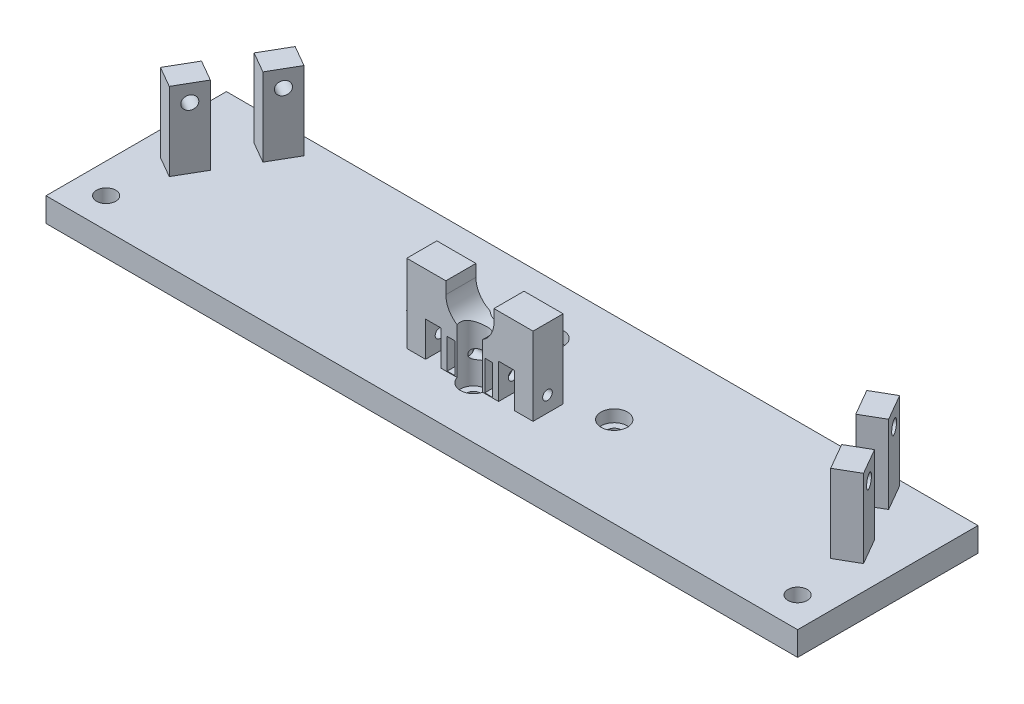
from build123d import *

# Parameters (mm, degrees)
SKETCH_1_W                = 125
SKETCH_1_H                = 30
EXTRUDE_1_DEPTH           = 4
EXTRUDE_3_DEPTH           = 5
SKETCH_11_R               = 0.8
CUT_EXTRUDE_6_DEPTH       = 77.439518575
CUT_EXTRUDE_7_DEPTH       = 1.3
CUT_EXTRUDE_8_DEPTH       = 1.3
EXTRUDE_4_DEPTH           = 13
SKETCH_15_R               = 1.1
CUT_EXTRUDE_9_DEPTH       = 115.99682112
SKETCH_16_R               = 1.1
CUT_EXTRUDE_10_DEPTH      = 115.99682112
CUT_EXTRUDE_11_DEPTH      = 66.576291447
CUT_EXTRUDE_11_DEPTH_BACK = 66.576291447
SKETCH_17_R               = 1.1
SKETCH_17_R_2             = 2.6
CUT_EXTRUDE_12_DEPTH      = 66.576291447
CUT_EXTRUDE_12_DEPTH_BACK = 2
SKETCH_18_R               = 2.2
SKETCH_19_R               = 1.6
CUT_EXTRUDE_13_DEPTH      = 66.576291447


with BuildPart() as part:
    # Эскиз1 → Бобышка-Вытянуть1 (new body)
    with BuildSketch(Plane(origin=(0, 0, 0), x_dir=(1, 0, 0), z_dir=(0, 1, 0))):
        Rectangle(SKETCH_1_W, SKETCH_1_H)
    extrude(amount=EXTRUDE_1_DEPTH)

    # Эскиз4 → Бобышка-Вытянуть3 (add)
    with BuildSketch(Plane.XY.offset(7)):
        with BuildLine():
            Line((-4, 15), (-4, 17))
            Line((-4, 17), (-10.5, 17))
            Line((-10.5, 17), (-10.5, 4))
            Line((-10.5, 4), (-7.375, 4))
            Line((-7.375, 4), (-7.375, 9.8))
            Line((-7.375, 9.8), (-4.775, 9.8))
            Line((-4.775, 9.8), (-4.775, 4))
            Line((-4.775, 4), (4.775, 4))
            Line((4.775, 4), (4.775, 9.8))
            Line((4.775, 9.8), (7.375, 9.8))
            Line((7.375, 9.8), (7.375, 4))
            Line((7.375, 4), (10.5, 4))
            Line((10.5, 4), (10.5, 17))
            Line((10.5, 17), (4, 17))
            Line((4, 17), (4, 15))
            ThreePointArc((4, 15), (0, 11), (-4, 15))
        make_face()
    extrude(amount=-EXTRUDE_3_DEPTH)

    # Эскиз11 → Вырез-Вытянуть6 (cut, through all)
    with BuildSketch(Plane(origin=(10.5, 0, 0), x_dir=(0, 0, -1), z_dir=(1, 0, 0))):
        with Locations((-4.6, 6.6)):
            Circle(SKETCH_11_R)
    extrude(amount=-CUT_EXTRUDE_6_DEPTH, mode=Mode.SUBTRACT)

    # Эскиз12 → Вырез-Вытянуть7 (cut)
    with BuildSketch(Plane.ZY.offset(3.775)):
        Polygon((5.466025404, 9.1), (7, 9.1), (7, 4.1), (5.466025404, 4.1), (3.156624327, 4.1), (1.713248654, 6.6), (3.156624327, 9.1), align=None)
    extrude(amount=-CUT_EXTRUDE_7_DEPTH, mode=Mode.SUBTRACT)

    # Эскиз13 → Вырез-Вытянуть8 (cut)
    with BuildSketch(Plane(origin=(3.775, 0, 0), x_dir=(0, 0, -1), z_dir=(1, 0, 0))):
        Polygon((-5.466025404, 9.1), (-7, 9.1), (-7, 4.1), (-5.466025404, 4.1), (-3.156624327, 4.1), (-1.713248654, 6.6), (-3.156624327, 9.1), align=None)
    extrude(amount=-CUT_EXTRUDE_8_DEPTH, mode=Mode.SUBTRACT)

    # Эскиз14 → Бобышка-Вытянуть4 (add)
    with BuildSketch(Plane(origin=(0, 4, 0), x_dir=(1, 0, 0), z_dir=(0, 1, 0))):
        Polygon((55, -2), (52.5, 2.330127019), (55.964101615, 4.330127019), (58.464101615, 0), align=None)
        Polygon((49.3, 7.872689603), (46.8, 12.202816622), (50.264101615, 14.202816622), (52.764101615, 9.872689603), align=None)
        Polygon((-55, -2), (-52.5, 2.330127019), (-55.964101615, 4.330127019), (-58.464101615, 0), align=None)
        Polygon((-49.3, 7.872689603), (-46.8, 12.202816622), (-50.264101615, 14.202816622), (-52.764101615, 9.872689603), align=None)
    extrude(amount=EXTRUDE_4_DEPTH)

    # Эскиз15 → Вырез-Вытянуть9 (cut, through all)
    with BuildSketch(Plane(origin=(-43.848076211, 0, -25.315698604), x_dir=(-0.5000000000000007, 0, 0.8660254037844383), z_dir=(-0.8660254037844383, 0, -0.5000000000000007))):
        with Locations((15.332050808, 14.2)):
            Circle(SKETCH_15_R)
        with Locations((26.732050808, 14.2)):
            Circle(SKETCH_15_R)
    extrude(amount=-CUT_EXTRUDE_9_DEPTH, mode=Mode.SUBTRACT)

    # Эскиз16 → Вырез-Вытянуть10 (cut, through all)
    with BuildSketch(Plane(origin=(43.848076211, 0, -25.315698604), x_dir=(-0.5000000000000019, 0, -0.8660254037844377), z_dir=(0.8660254037844377, 0, -0.5000000000000019))):
        with Locations((-26.732050808, 14.2)):
            Circle(SKETCH_16_R)
        with Locations((-15.332050808, 14.2)):
            Circle(SKETCH_16_R)
    extrude(amount=-CUT_EXTRUDE_10_DEPTH, mode=Mode.SUBTRACT)

    # Эскиз17 → Вырез-Вытянуть11 (cut, two sides: drawn at the far end of the back side and taken through both)
    with BuildSketch(Plane(origin=(0, 4, 0), x_dir=(1, 0, 0), z_dir=(0, 1, 0)).offset(-CUT_EXTRUDE_11_DEPTH_BACK)):
        with Locations((-14.4, 0)):
            Circle(SKETCH_17_R)
        with Locations((17, 0)):
            Circle(SKETCH_17_R)
        with Locations((0, 6.4)):
            Circle(SKETCH_17_R)
        with Locations((0, -6.4)):
            Circle(SKETCH_17_R)
        Circle(SKETCH_17_R_2)
    extrude(amount=CUT_EXTRUDE_11_DEPTH + CUT_EXTRUDE_11_DEPTH_BACK, mode=Mode.SUBTRACT)

    # Эскиз18 → Вырез-Вытянуть12 (cut, two sides: drawn at the far end of the back side and taken through both)
    with BuildSketch(Plane(origin=(0, 4, 0), x_dir=(1, 0, 0), z_dir=(0, 1, 0)).offset(-CUT_EXTRUDE_12_DEPTH_BACK)):
        with Locations((-14.4, 0)):
            Circle(SKETCH_18_R)
        with Locations((17, 0)):
            Circle(SKETCH_18_R)
        with Locations((0, -6.4)):
            Circle(SKETCH_18_R)
        with Locations((0, 6.4)):
            Circle(SKETCH_18_R)
    extrude(amount=CUT_EXTRUDE_12_DEPTH + CUT_EXTRUDE_12_DEPTH_BACK, mode=Mode.SUBTRACT)

    # Эскиз19 → Вырез-Вытянуть13 (cut, through all)
    with BuildSketch(Plane(origin=(0, 4, 0), x_dir=(1, 0, 0), z_dir=(0, 1, 0))):
        with Locations((-57.5, -10)):
            Circle(SKETCH_19_R)
        with Locations((57.5, -10)):
            Circle(SKETCH_19_R)
    extrude(amount=-CUT_EXTRUDE_13_DEPTH, mode=Mode.SUBTRACT)


solid = part.part
